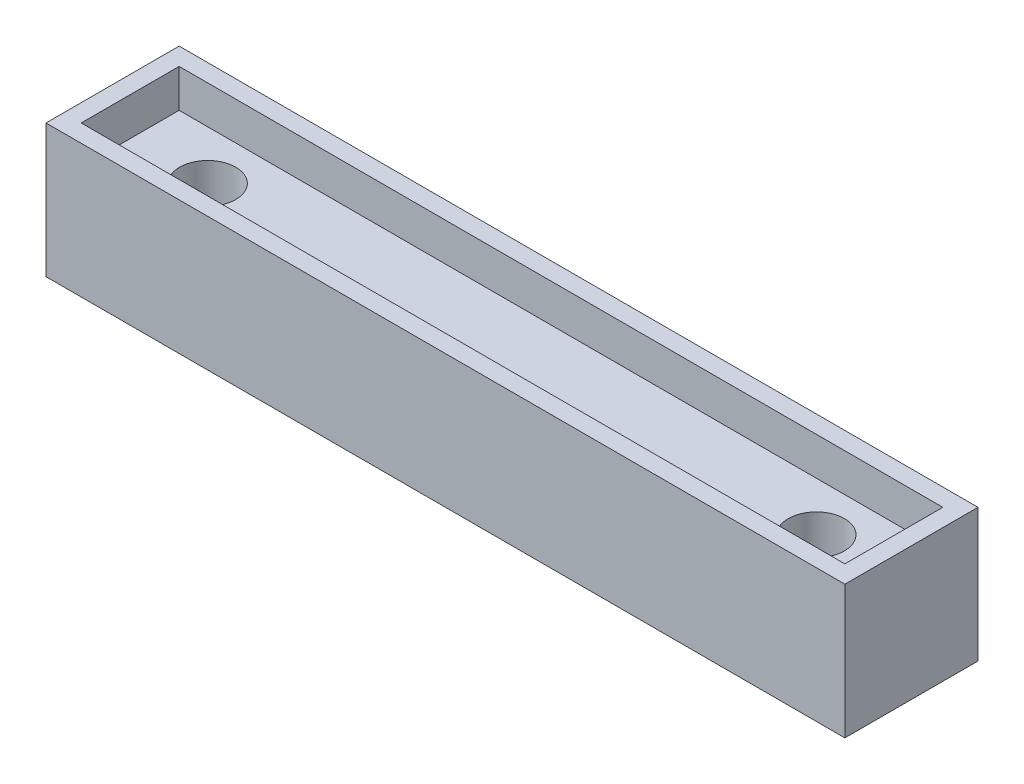
from build123d import *

# Parameters (mm, degrees)
SKETCH1_W            = 42
SKETCH1_H            = 7
RISER_DEPTH          = 7
SKETCH2_R            = 1.475
MOUNTING_HOLES_DEPTH = 44.150898021
SKETCH3_W            = 40.15
SKETCH3_H            = 5.15
RECESS_4_SIDES_DEPTH = 2


with BuildPart() as part:
    # Sketch1 → Riser (new body)
    with BuildSketch(Plane(origin=(0, 0, 0), x_dir=(1, 0, 0), z_dir=(0, 1, 0))):
        with Locations((21, 3.5)):
            Rectangle(SKETCH1_W, SKETCH1_H)
    extrude(amount=RISER_DEPTH)

    # Sketch2 → Mounting Holes (cut, through all)
    with BuildSketch(Plane.XZ):
        with Locations((5, -3.5)):
            Circle(SKETCH2_R)
        with Locations((37, -3.5)):
            Circle(SKETCH2_R)
    extrude(amount=-MOUNTING_HOLES_DEPTH, mode=Mode.SUBTRACT)

    # Sketch3 → Recess (4-Sides) (cut)
    with BuildSketch(Plane(origin=(0, 7, 0), x_dir=(1, 0, 0), z_dir=(0, 1, 0))):
        with Locations((21, 3.5)):
            Rectangle(SKETCH3_W, SKETCH3_H)
    extrude(amount=-RECESS_4_SIDES_DEPTH, mode=Mode.SUBTRACT)


solid = part.part
